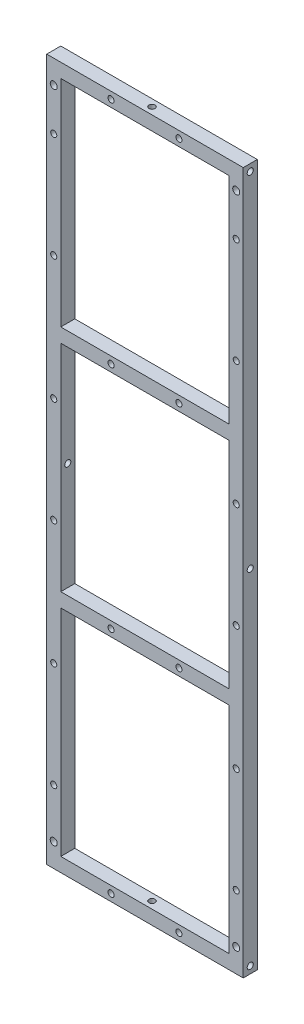
from build123d import *

# Parameters (mm, degrees)
SKETCH1_W            = 84
SKETCH1_H            = 300
SKETCH1_W_2          = 72
SKETCH1_H_2          = 92
BOSS_EXTRUDE1_DEPTH  = 6
SKETCH2_R            = 1.3
CUT_EXTRUDE1_DEPTH   = 10
SKETCH4_R            = 1.3
CUT_EXTRUDE3_DEPTH   = 10
SKETCH5_R            = 1.3
CUT_EXTRUDE4_DEPTH   = 10
SKETCH6_R            = 1.5
CUT_EXTRUDE5_DEPTH   = 10
LPATTERN1_COUNT      = 2
LPATTERN1_PITCH      = 78
LPATTERN1_COUNT_DIR2 = 2
LPATTERN1_PITCH_DIR2 = 280


with BuildPart() as part:
    # Sketch1 → Boss-Extrude1 (new body)
    with BuildSketch(Plane.XY):
        Rectangle(SKETCH1_W, SKETCH1_H)
        with Locations((0, 98)):
            Rectangle(SKETCH1_W_2, SKETCH1_H_2, mode=Mode.SUBTRACT)
        with Locations((0, -98)):
            Rectangle(SKETCH1_W_2, SKETCH1_H_2, mode=Mode.SUBTRACT)
        Rectangle(SKETCH1_W_2, SKETCH1_H_2, mode=Mode.SUBTRACT)
    extrude(amount=BOSS_EXTRUDE1_DEPTH)

    # Sketch2 → Cut-Extrude1 (cut)
    with BuildSketch(Plane(origin=(42, 0, 0), x_dir=(0, 0, -1), z_dir=(1, 0, 0))):
        with Locations((-3, 147)):
            Circle(SKETCH2_R)
        with Locations((-3, 0)):
            Circle(SKETCH2_R)
        with Locations((-3, -147)):
            Circle(SKETCH2_R)
        with Locations((-3, -294)):
            Circle(SKETCH2_R)
    cut_extrude1 = extrude(amount=-CUT_EXTRUDE1_DEPTH, mode=Mode.SUBTRACT)

    # Mirror1: Cut-Extrude1 across plane
    add(cut_extrude1.mirror(Plane(origin=(0, 0, 0), x_dir=(0, 0, 1), z_dir=(1, 0, 0))), mode=Mode.SUBTRACT)

    # Sketch4 → Cut-Extrude3 (cut)
    with BuildSketch(Plane.XY.offset(6)):
        with Locations((-14.5, 147)):
            Circle(SKETCH4_R)
        with Locations((14.5, 147)):
            Circle(SKETCH4_R)
        with Locations((-39, 122)):
            Circle(SKETCH4_R)
        with Locations((-14.5, 49)):
            Circle(SKETCH4_R)
        with Locations((14.5, 49)):
            Circle(SKETCH4_R)
        with Locations((-14.5, -49)):
            Circle(SKETCH4_R)
        with Locations((14.5, -49)):
            Circle(SKETCH4_R)
        with Locations((-14.5, -147)):
            Circle(SKETCH4_R)
        with Locations((14.5, -147)):
            Circle(SKETCH4_R)
        with Locations((39, 122)):
            Circle(SKETCH4_R)
        with Locations((39, 77)):
            Circle(SKETCH4_R)
        with Locations((-39, 77)):
            Circle(SKETCH4_R)
        with Locations((-39, 24)):
            Circle(SKETCH4_R)
        with Locations((39, 24)):
            Circle(SKETCH4_R)
        with Locations((39, -21)):
            Circle(SKETCH4_R)
        with Locations((-39, -21)):
            Circle(SKETCH4_R)
        with Locations((-39, -74)):
            Circle(SKETCH4_R)
        with Locations((39, -74)):
            Circle(SKETCH4_R)
        with Locations((39, -119)):
            Circle(SKETCH4_R)
        with Locations((-39, -119)):
            Circle(SKETCH4_R)
    extrude(amount=-CUT_EXTRUDE3_DEPTH, mode=Mode.SUBTRACT)

    # Sketch5 → Cut-Extrude4 (cut)
    with BuildSketch(Plane(origin=(0, 150, 0), x_dir=(1, 0, 0), z_dir=(0, 1, 0))):
        with Locations((0, -3)):
            Circle(SKETCH5_R)
    cut_extrude4 = extrude(amount=-CUT_EXTRUDE4_DEPTH, mode=Mode.SUBTRACT)

    # Mirror2: Cut-Extrude4 across plane
    add(cut_extrude4.mirror(Plane.ZX), mode=Mode.SUBTRACT)

    # Sketch6 → Cut-Extrude5 (cut)
    with BuildSketch(Plane.XY.offset(6)):
        with Locations((-39, 140)):
            Circle(SKETCH6_R)
    cut_extrude5 = extrude(amount=-CUT_EXTRUDE5_DEPTH, mode=Mode.SUBTRACT)

    # LPattern1: Cut-Extrude5 2 × 2
    with Locations(*[(i * LPATTERN1_PITCH, -j * LPATTERN1_PITCH_DIR2, 0) for i in range(LPATTERN1_COUNT) for j in range(LPATTERN1_COUNT_DIR2) if (i, j) != (0, 0)]):
        add(cut_extrude5, mode=Mode.SUBTRACT)


solid = part.part
